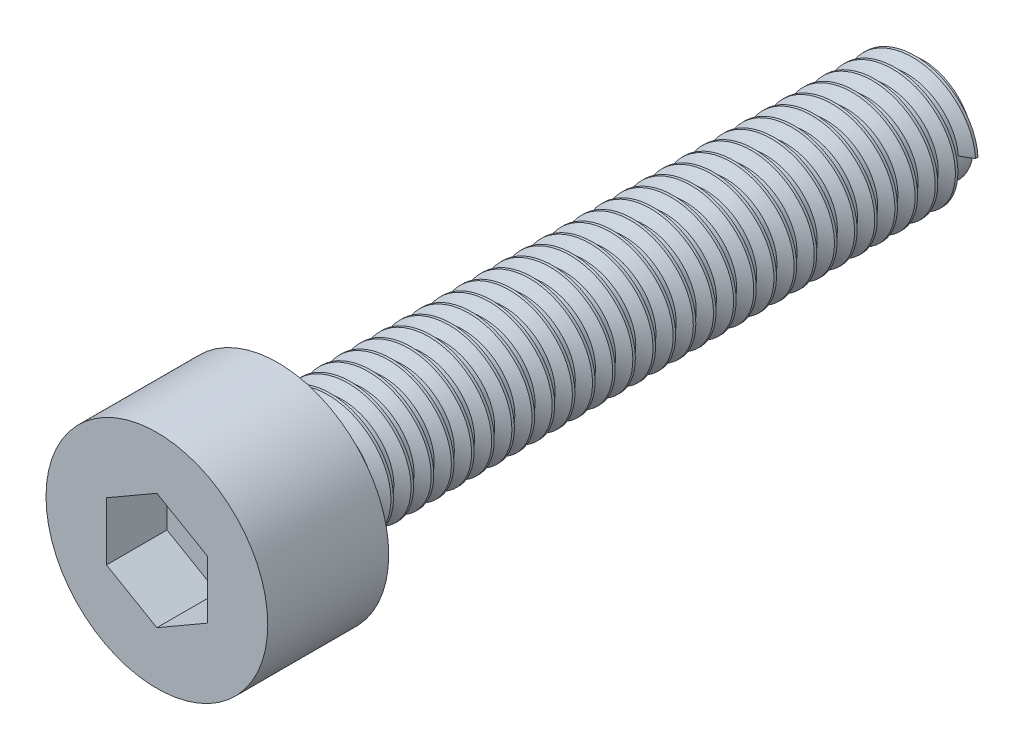
from build123d import *

# Parameters (mm, degrees)
SKETCH1_R           = 2.75
BOSS_EXTRUDE1_DEPTH = 3
SKETCH2_R           = 1.25
BOSS_EXTRUDE2_DEPTH = 16
CUT_EXTRUDE1_DEPTH  = 1.5
THREAD1_PITCH       = 0.5


with BuildPart() as part:
    # Sketch1 → Boss-Extrude1 (new body)
    with BuildSketch(Plane.XY):
        Circle(SKETCH1_R)
    extrude(amount=BOSS_EXTRUDE1_DEPTH)

    # Sketch2 → Boss-Extrude2 (add)
    with BuildSketch(Plane(origin=(0, 0, 0), x_dir=(-1, 0, 0), z_dir=(0, 0, -1))):
        Circle(SKETCH2_R)
    extrude(amount=BOSS_EXTRUDE2_DEPTH)

    # Sketch3 → Cut-Extrude1 (cut)
    with BuildSketch(Plane.XY.offset(3)):
        Polygon((0, 1.443375673), (-1.25, 0.721687836), (-1.25, -0.721687836), (0, -1.443375673), (1.25, -0.721687836), (1.25, 0.721687836), align=None)
    extrude(amount=-CUT_EXTRUDE1_DEPTH, mode=Mode.SUBTRACT)

    # Thread1: the profile of Thread Profile1 profile screwed along a right-hand helix of 32 turns, 6 arcs to a turn; built about Z, then put on its axis
    thread1_z = Axis((0, 0, 0), (0, 0, 1))
    thread1_corners = [(1.2497, 0, -0.000173205), (1.520632938, 0, 0.156249999), (1.520632937, 0, 0.218749999), (1.2497, 0, 0.375173204)]
    with BuildLine(mode=Mode.PRIVATE) as thread1_profile:
        Line(thread1_corners[0], thread1_corners[1])
        Line(thread1_corners[1], thread1_corners[2])
        Line(thread1_corners[2], thread1_corners[3])
        Line(thread1_corners[3], thread1_corners[0])
    thread1_cap = Face(thread1_profile.wire())
    thread1_turn_angles = [0, 30, 60, 90, 120, 150, 180, 210, 240, 270, 300, 330, 360]
    thread1_turn_weights = [1, 0.8660254037844387, 1, 0.8660254037844387, 1, 0.8660254037844387, 1, 0.8660254037844387, 1, 0.8660254037844387, 1, 0.8660254037844387, 1]
    thread1_turn_rails = [Edge.make_bspline([Vector(p[0], p[1], 0).rotate(thread1_z, thread1_turn_angles[k]) / thread1_turn_weights[k] + Vector(0, 0, p[2] + THREAD1_PITCH * thread1_turn_angles[k] / 360) for k in range(13)], [0, 0, 0, 1, 1, 2, 2, 3, 3, 4, 4, 5, 5, 6, 6, 6], 2, thread1_turn_weights) for p in thread1_corners]
    thread1_turn_sides = [Face.make_surface_from_curves(thread1_turn_rails[p[0]], thread1_turn_rails[p[1]]) for p in [(0, 1), (1, 2), (2, 3), (3, 0)]]
    thread1 = Plane(origin=(0, 0, -16), x_dir=(1, 0, 0), z_dir=(0, 0, 1)) * Solid(Shell([*[p.moved(Location((0, 0, THREAD1_PITCH * i))) for i in range(32) for p in thread1_turn_sides], thread1_cap, thread1_cap.rotate(thread1_z, 11520).moved(Location((0, 0, THREAD1_PITCH * 11520 / 360)))]))
    add(thread1)


solid = part.part
